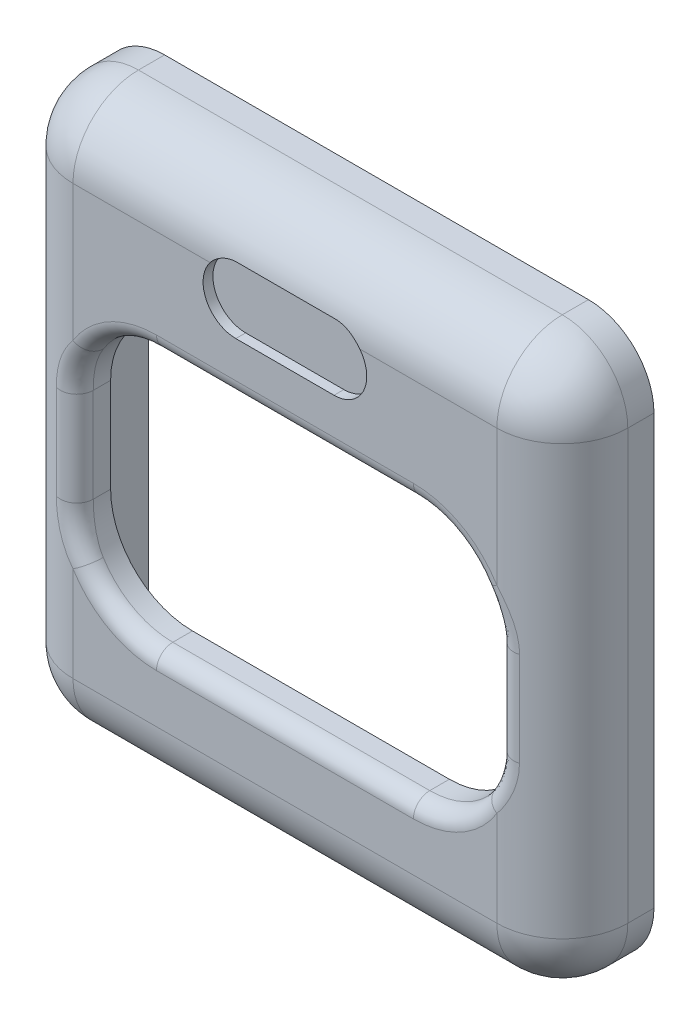
from build123d import *

# Parameters (mm, degrees)
SKETCH_1_W          = 33.9
SKETCH_1_H          = 34.2
SKETCH_1_W_2        = 27.9
SKETCH_1_H_2        = 28.2
EXTRUDE_1_DEPTH     = 4
SKETCH_2_W          = 33.9
SKETCH_2_H          = 34.2
EXTRUDE_2_DEPTH     = 2.2
FILLET_1_R          = 4
CUT_EXTRUDE_1_DEPTH = 0.6
FILLET_2_R          = 4
SKETCH_4_W          = 27.9
SKETCH_4_H          = 28.2
EXTRUDE_3_DEPTH     = 1.6
FILLET_3_R          = 1


with BuildPart() as part:
    # Эскиз1 → Бобышка-Вытянуть1 (new body)
    with BuildSketch(Plane.XY):
        with Locations((-48, -29.505896468)):
            Rectangle(SKETCH_1_W, SKETCH_1_H)
        with Locations((-48, -29.505896468)):
            Rectangle(SKETCH_1_W_2, SKETCH_1_H_2, mode=Mode.SUBTRACT)
    extrude(amount=EXTRUDE_1_DEPTH)

    # Эскиз2 → Бобышка-Вытянуть2 (add)
    with BuildSketch(Plane.XY.offset(4)):
        with Locations((-48, -29.505896468)):
            Rectangle(SKETCH_2_W, SKETCH_2_H)
        with BuildLine():
            Line((-60.85, -27.875896468), (-60.85, -33.635896468))
            ThreePointArc((-60.85, -33.635896468), (-59.385533906, -37.171430374), (-55.85, -38.635896468))
            Line((-55.85, -38.635896468), (-40.15, -38.635896468))
            ThreePointArc((-40.15, -38.635896468), (-36.614466094, -37.171430374), (-35.15, -33.635896468))
            Line((-35.15, -33.635896468), (-35.15, -27.875896468))
            ThreePointArc((-35.15, -27.875896468), (-36.614466094, -24.340362562), (-40.15, -22.875896468))
            Line((-40.15, -22.875896468), (-55.85, -22.875896468))
            ThreePointArc((-55.85, -22.875896468), (-59.385533906, -24.340362562), (-60.85, -27.875896468))
        make_face(mode=Mode.SUBTRACT)
    extrude(amount=-EXTRUDE_2_DEPTH)

    # Скругление1
    fillet_1_edges = [part.edges().sort_by_distance(p)[0] for p in [
        (-31.05, -46.605896468, 2),
        (-64.95, -46.605896468, 2),
        (-64.95, -12.405896468, 2),
        (-31.05, -12.405896468, 2),
    ]]
    fillet(fillet_1_edges, radius=FILLET_1_R)

    # Эскиз3 → Вырез-Вытянуть1 (cut)
    with BuildSketch(Plane.XY.offset(4)):
        with BuildLine():
            Line((-45, -19.640896468), (-51, -19.640896468))
            ThreePointArc((-51, -19.640896468), (-53, -17.640896468), (-51, -15.640896468))
            Line((-51, -15.640896468), (-45, -15.640896468))
            ThreePointArc((-45, -15.640896468), (-43, -17.640896468), (-45, -19.640896468))
        make_face()
    extrude(amount=-CUT_EXTRUDE_1_DEPTH, mode=Mode.SUBTRACT)

    # Скругление2
    # the kernel refuses this fillet: 4 mm, written as the material it takes off along each edge
    with BuildSketch(Plane(origin=(-35.05, -42.605896468, 4), x_dir=(0, -1, 0), z_dir=(-1, 0, 0))) as fillet_2_piece_1:
        with BuildLine():
            CenterArc((4 - FILLET_2_R, -FILLET_2_R), FILLET_2_R, 0, 90)
            Line((4, -FILLET_2_R), (4, 0))
            Line((4, 0), (4 - FILLET_2_R, 0))
        make_face()
    revolve(axis=Axis((-35.05, -42.605896468, 4), (0, 0, 1)), revolution_arc=90, mode=Mode.SUBTRACT)
    with BuildSketch(Plane(origin=(-60.95, -46.605896468, 4), x_dir=(0, 1, 0), z_dir=(1, 0, 0))) as fillet_2_piece_2:
        with BuildLine():
            CenterArc((FILLET_2_R, -FILLET_2_R), FILLET_2_R, 90, 90)
            Line((0, -FILLET_2_R), (0, 0))
            Line((0, 0), (FILLET_2_R, 0))
        make_face()
    extrude(amount=25.9, mode=Mode.SUBTRACT)
    with BuildSketch(Plane(origin=(-60.95, -42.605896468, 4), x_dir=(-1, 0, 0), z_dir=(0, 1, 0))) as fillet_2_piece_3:
        with BuildLine():
            CenterArc((4 - FILLET_2_R, -FILLET_2_R), FILLET_2_R, 0, 90)
            Line((4, -FILLET_2_R), (4, 0))
            Line((4, 0), (4 - FILLET_2_R, 0))
        make_face()
    revolve(axis=Axis((-60.95, -42.605896468, 4), (0, 0, 1)), revolution_arc=90, mode=Mode.SUBTRACT)
    with BuildSketch(Plane(origin=(-64.95, -16.405896468, 4), x_dir=(1, 0, 0), z_dir=(0, -1, 0)), Plane(origin=(-31.05, -42.605896468, 4), x_dir=(-1, 0, 0), z_dir=(0, 1, 0))) as fillet_2_piece_4:
        with BuildLine():
            CenterArc((FILLET_2_R, -FILLET_2_R), FILLET_2_R, 90, 90)
            Line((0, -FILLET_2_R), (0, 0))
            Line((0, 0), (FILLET_2_R, 0))
        make_face()
    extrude(amount=26.2, mode=Mode.SUBTRACT)
    with BuildSketch(Plane(origin=(-60.95, -16.405896468, 4), x_dir=(0, 1, 0), z_dir=(1, 0, 0))) as fillet_2_piece_5:
        with BuildLine():
            CenterArc((4 - FILLET_2_R, -FILLET_2_R), FILLET_2_R, 0, 90)
            Line((4 - FILLET_2_R, 0), (4, 0))
            Line((4, 0), (4, -FILLET_2_R))
        make_face()
    revolve(axis=Axis((-60.95, -16.405896468, 4), (0, 0, 1)), revolution_arc=90, mode=Mode.SUBTRACT)
    with BuildSketch(Plane(origin=(-35.05, -12.405896468, 4), x_dir=(0, 0, -1), z_dir=(-1, 0, 0))) as fillet_2_piece_6:
        with BuildLine():
            CenterArc((FILLET_2_R, FILLET_2_R), FILLET_2_R, 180, 90)
            Line((0, FILLET_2_R), (0, 0))
            Line((0, 0), (FILLET_2_R, 0))
        make_face()
    extrude(amount=25.9, mode=Mode.SUBTRACT)
    with BuildSketch(Plane(origin=(-35.05, -16.405896468, 4), x_dir=(0, 1, 0), z_dir=(-1, 0, 0))) as fillet_2_piece_7:
        with BuildLine():
            CenterArc((4 - FILLET_2_R, FILLET_2_R), FILLET_2_R, 270, 90)
            Line((4 - FILLET_2_R, 0), (4, 0))
            Line((4, 0), (4, FILLET_2_R))
        make_face()
    revolve(axis=Axis((-35.05, -16.405896468, 4), (0, 0, -1)), revolution_arc=90, mode=Mode.SUBTRACT)

    # Эскиз4 → Бобышка-Вытянуть3 (add)
    with BuildSketch(Plane(origin=(0, 0, 0), x_dir=(-1, 0, 0), z_dir=(0, 0, -1))):
        with BuildLine():
            Line((60.95, -12.405896468), (35.05, -12.405896468))
            ThreePointArc((35.05, -12.405896468), (32.221572875, -13.577469343), (31.05, -16.405896468))
            Line((31.05, -16.405896468), (31.05, -42.605896468))
            ThreePointArc((31.05, -42.605896468), (32.221572875, -45.434323593), (35.05, -46.605896468))
            Line((35.05, -46.605896468), (60.95, -46.605896468))
            ThreePointArc((60.95, -46.605896468), (63.778427125, -45.434323593), (64.95, -42.605896468))
            Line((64.95, -42.605896468), (64.95, -16.405896468))
            ThreePointArc((64.95, -16.405896468), (63.778427125, -13.577469343), (60.95, -12.405896468))
        make_face()
        with Locations((48, -29.505896468)):
            Rectangle(SKETCH_4_W, SKETCH_4_H, mode=Mode.SUBTRACT)
    extrude(amount=EXTRUDE_3_DEPTH)

    # Скругление3
    fillet_3_edges = [part.edges().sort_by_distance(p)[0] for p in [
        (-48, -38.635896468, 4),
        (-36.614466094, -37.171430374, 4),
        (-35.15, -30.755896468, 4),
        (-36.614466094, -24.340362562, 4),
        (-48, -22.875896468, 4),
        (-59.385533906, -24.340362562, 4),
        (-60.85, -30.755896468, 4),
        (-59.385533906, -37.171430374, 4),
    ]]
    fillet(fillet_3_edges, radius=FILLET_3_R)


solid = part.part
